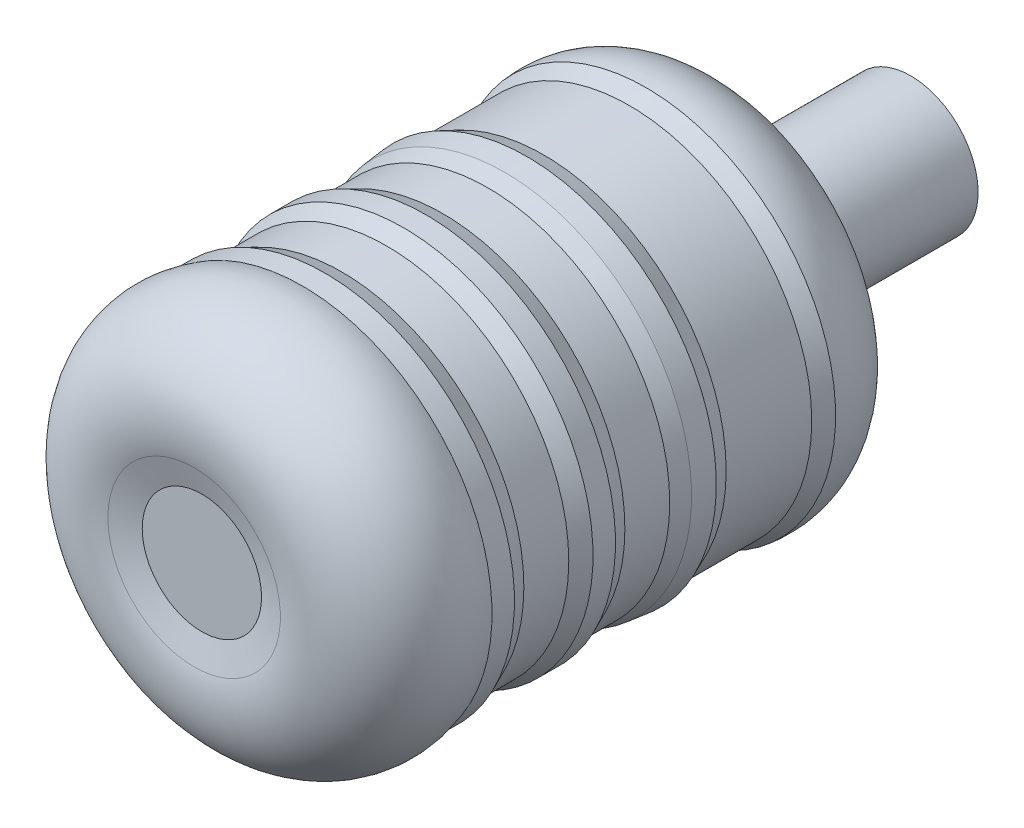
from build123d import *


# Read off the part's stored shape, not the designer's step: Shell1
with BuildPart() as part:
    # Sketch1 → Revolve2 (revolve)
    with BuildSketch(Plane(origin=(0, 0, 0), x_dir=(1, 0, 0), z_dir=(0, 1, 0)), mode=Mode.PRIVATE) as revolve2_sk:
        with BuildLine():
            Line((544.274797421, 5.502816416), (563.274797421, 0))
            ThreePointArc((563.274797421, 0), (623.582898909, 16.246544551), (636.774797421, 77.295632411))
            Line((636.774797421, 77.295632411), (636.774797421, 93.295632411))
            Line((636.774797421, 93.295632411), (631.478226984, 105.295632411))
            Line((631.478226984, 105.295632411), (631.478226984, 137.295632411))
            Line((631.478226984, 137.295632411), (636.774797421, 149.295632411))
            Line((636.774797421, 149.295632411), (636.774797421, 165.295632411))
            Line((636.774797421, 165.295632411), (631.478226984, 177.295632411))
            Line((631.478226984, 177.295632411), (631.478226984, 209.268332016))
            Line((631.478226984, 209.268332016), (635.026398437, 221.268332016))
            Line((635.026398437, 221.268332016), (636.774797421, 237.172517031))
            Line((636.774797421, 237.172517031), (631.774797421, 249.172517031))
            Line((631.774797421, 249.172517031), (631.774797421, 310.172517031))
            Line((631.774797421, 310.172517031), (636.774797421, 322.172517031))
            ThreePointArc((636.774797421, 322.172517031), (628.250273774, 358.907634295), (598.068243539, 381.516955266))
            Line((598.068243539, 381.516955266), (559.410697446, 393.179147668))
            ThreePointArc((559.410697446, 393.179147668), (552.576151724, 396.231371583), (549.774797421, 403.172517031))
            Line((549.774797421, 403.172517031), (549.774797421, 510.755898755))
            Line((549.774797421, 510.755898755), (501.774797421, 510.755898755))
            Line((501.774797421, 510.755898755), (501.774797421, 5.502816416))
            Line((501.774797421, 5.502816416), (544.274797421, 5.502816416))
        make_face()
    revolve(revolve2_sk.sketch.rotate(Axis((501.774797421, 0, -510.755898755), (0, 0, 1)), 180), axis=Axis((501.774797421, 0, -510.755898755), (0, 0, 1)))

    # Shell1 outline → Shell1 (revolve, cut)
    with BuildSketch(Plane(origin=(501.774797421, 0, 0), x_dir=(1, 0, 0), z_dir=(0, -1, 0))):
        with BuildLine():
            Line((46, -510.755898755), (46, -403.172517031))
            ThreePointArc((46, -403.172517031), (49.268620028, -394.940688329), (57.293833963, -391.193312987))
            Line((57.293833963, -391.193312987), (95.715800563, -379.602190107))
            ThreePointArc((95.715800563, -379.602190107), (124.725833298, -357.928881841), (133.047238553, -322.685889558))
            Line((133.047238553, -322.685889558), (128, -310.572517031))
            Line((128, -310.572517031), (128, -248.772517031))
            Line((128, -248.772517031), (132.955672917, -236.878902031))
            Line((132.955672917, -236.878902031), (131.283079917, -221.664280672))
            Line((131.283079917, -221.664280672), (127.703429563, -209.557818284))
            Line((127.703429563, -209.557818284), (127.703429563, -176.873879275))
            Line((127.703429563, -176.873879275), (133, -164.873879275))
            Line((133, -164.873879275), (133, -149.717385547))
            Line((133, -149.717385547), (127.703429563, -137.717385547))
            Line((127.703429563, -137.717385547), (127.703429563, -104.873879275))
            Line((127.703429563, -104.873879275), (133, -92.873879275))
            Line((133, -92.873879275), (133, -76.954926098))
            ThreePointArc((133, -76.954926098), (120.473185429, -17.745415679), (62.058668867, -1.920389226))
            Line((62.058668867, -1.920389226), (42.783790589, -7.502816416))
            Line((42.783790589, -7.502816416), (0, -7.502816416))
            Line((0, -7.502816416), (0, -510.755898755))
            Line((0, -510.755898755), (46, -510.755898755))
        make_face()
    revolve(axis=Axis((501.774797421, 0, 0), (0, 0, 1)), mode=Mode.SUBTRACT)


solid = part.part
